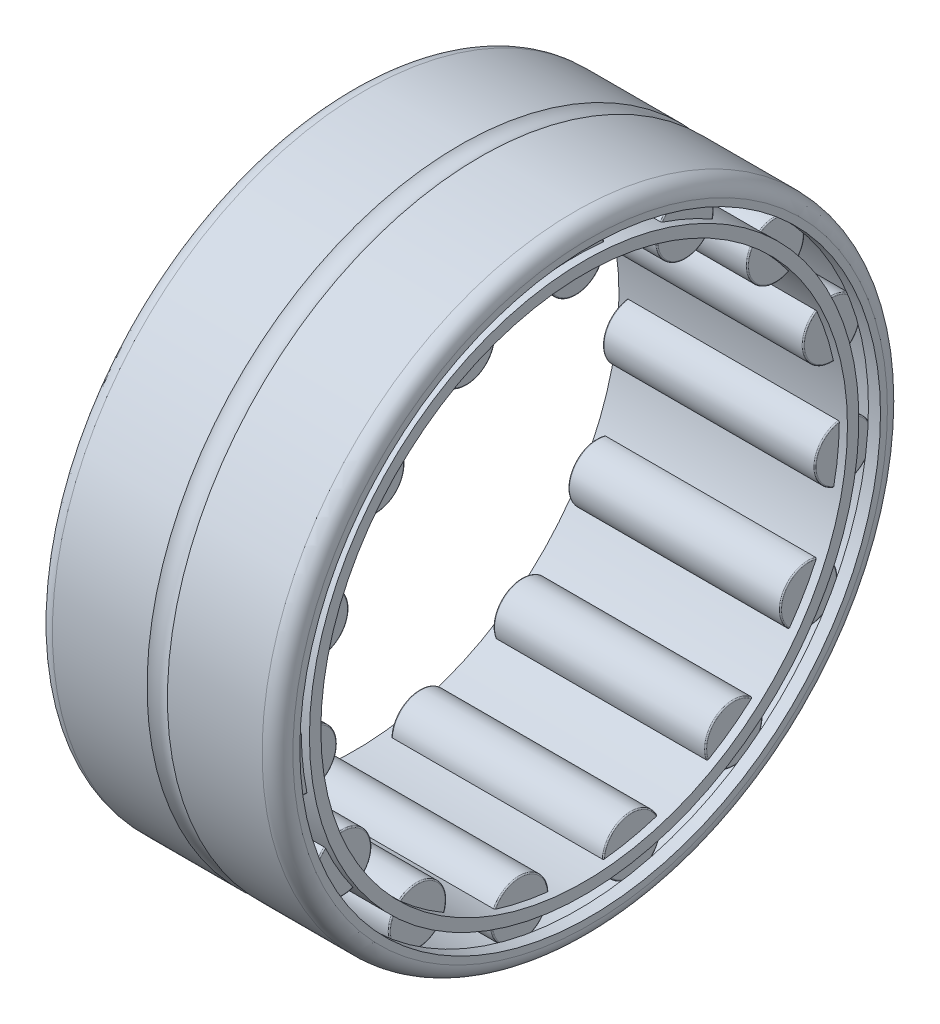
from build123d import *

# Parameters (mm, degrees)
CAGSPISKE_W           = 30.1625
CAGSPISKE_H           = 1.50642
ROLLERSDETAILED_COUNT = 15
ROLLERSDETAILED_ANGLE = 336


with BuildPart() as part:
    # InnRacSke → Race (revolve)
    with BuildSketch(Plane.XY):
        with BuildLine():
            Line((-14.2875, 38.3286), (-15.875, 38.3286))
            Line((-15.875, 38.3286), (-15.875, 39.243))
            ThreePointArc((-15.875, 39.243), (-15.279840979, 40.679840979), (-13.843, 41.275))
            Line((-13.843, 41.275), (-1.344041666, 41.275))
            ThreePointArc((-1.344041666, 41.275), (0, 40.767), (1.344041666, 41.275))
            Line((1.344041666, 41.275), (13.843, 41.275))
            ThreePointArc((13.843, 41.275), (15.279840979, 40.679840979), (15.875, 39.243))
            Line((15.875, 39.243), (15.875, 38.3286))
            Line((15.875, 38.3286), (14.2875, 38.3286))
            Line((14.2875, 38.3286), (14.2875, 39.2811))
            Line((14.2875, 39.2811), (-14.2875, 39.2811))
            Line((-14.2875, 39.2811), (-14.2875, 38.3286))
        make_face()
    revolve(axis=Axis((-31.75, 0, 0), (1, 0, 0)))

    # RolDetSke → RollerDetailed (revolve)
    with BuildSketch(Plane.XY):
        with BuildLine():
            Line((-14.00175, 39.130958), (-14.00175, 35.51555))
            Line((-14.00175, 35.51555), (14.00175, 35.51555))
            Line((14.00175, 35.51555), (14.00175, 39.130958))
            ThreePointArc((14.00175, 39.130958), (13.95762798, 39.23747798), (13.851108, 39.2816))
            Line((13.851108, 39.2816), (-13.851108, 39.2816))
            ThreePointArc((-13.851108, 39.2816), (-13.95762798, 39.23747798), (-14.00175, 39.130958))
        make_face()
    rollerdetailed = revolve(axis=Axis((-28.575, 35.51555, 0), (1, 0, 0)))

    # CagSpiSke → CageSpine (revolve)
    with BuildSketch(Plane.XY):
        with Locations((0, 35.51555)):
            Rectangle(CAGSPISKE_W, CAGSPISKE_H)
    revolve(axis=Axis((-31.75, 0, 0), (1, 0, 0)))

    # RollersDetailed: RollerDetailed ×15 about axis
    rollersdetailed_axis = Axis((-50, 0, 0), (1, 0, 0))
    for i in range(1, ROLLERSDETAILED_COUNT):
        add(rollerdetailed.rotate(rollersdetailed_axis, i * ROLLERSDETAILED_ANGLE / (ROLLERSDETAILED_COUNT - 1)))


solid = part.part
